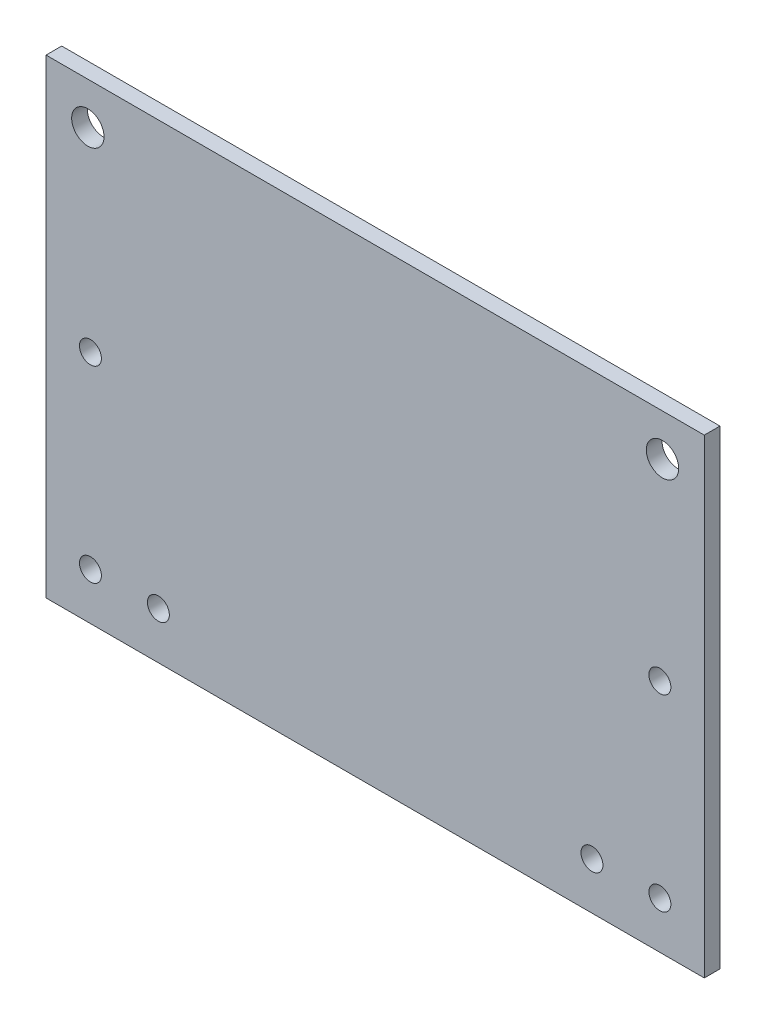
from build123d import *

# Parameters (mm, degrees)
SZKIC1_W                    = 126
SZKIC1_H                    = 90
DODANIE_WYCI_GNI_CIE1_DEPTH = 3
SZKIC2_R                    = 2.1
WYTNIJ_WYCI_GNI_CIE1_DEPTH  = 3
SZKIC3_R                    = 3.1
WYTNIJ_WYCI_GNI_CIE2_DEPTH  = 10
SZKIC4_R                    = 2.1
WYTNIJ_WYCI_GNI_CIE3_DEPTH  = 10


with BuildPart() as part:
    # Szkic1 → Dodanie-wyciągnięcie1 (new body)
    with BuildSketch(Plane.XY):
        with Locations((63, 45)):
            Rectangle(SZKIC1_W, SZKIC1_H)
    extrude(amount=DODANIE_WYCI_GNI_CIE1_DEPTH)

    # Szkic2 → Wytnij-wyciągnięcie1 (cut)
    with BuildSketch(Plane.XY.offset(3)):
        with Locations((21.5, 9)):
            Circle(SZKIC2_R)
        with Locations((104.5, 9)):
            Circle(SZKIC2_R)
        with Locations((8.5, 9)):
            Circle(SZKIC2_R)
        with Locations((117.5, 9)):
            Circle(SZKIC2_R)
    extrude(amount=-WYTNIJ_WYCI_GNI_CIE1_DEPTH, mode=Mode.SUBTRACT)

    # Szkic3 → Wytnij-wyciągnięcie2 (cut)
    with BuildSketch(Plane.XY.offset(3)):
        with Locations((8, 82)):
            Circle(SZKIC3_R)
        with Locations((118, 82)):
            Circle(SZKIC3_R)
    extrude(amount=-WYTNIJ_WYCI_GNI_CIE2_DEPTH, mode=Mode.SUBTRACT)

    # Szkic4 → Wytnij-wyciągnięcie3 (cut)
    with BuildSketch(Plane.XY.offset(3)):
        with Locations((8.5, 45)):
            Circle(SZKIC4_R)
        with Locations((117.5, 45)):
            Circle(SZKIC4_R)
    extrude(amount=-WYTNIJ_WYCI_GNI_CIE3_DEPTH, mode=Mode.SUBTRACT)


solid = part.part
